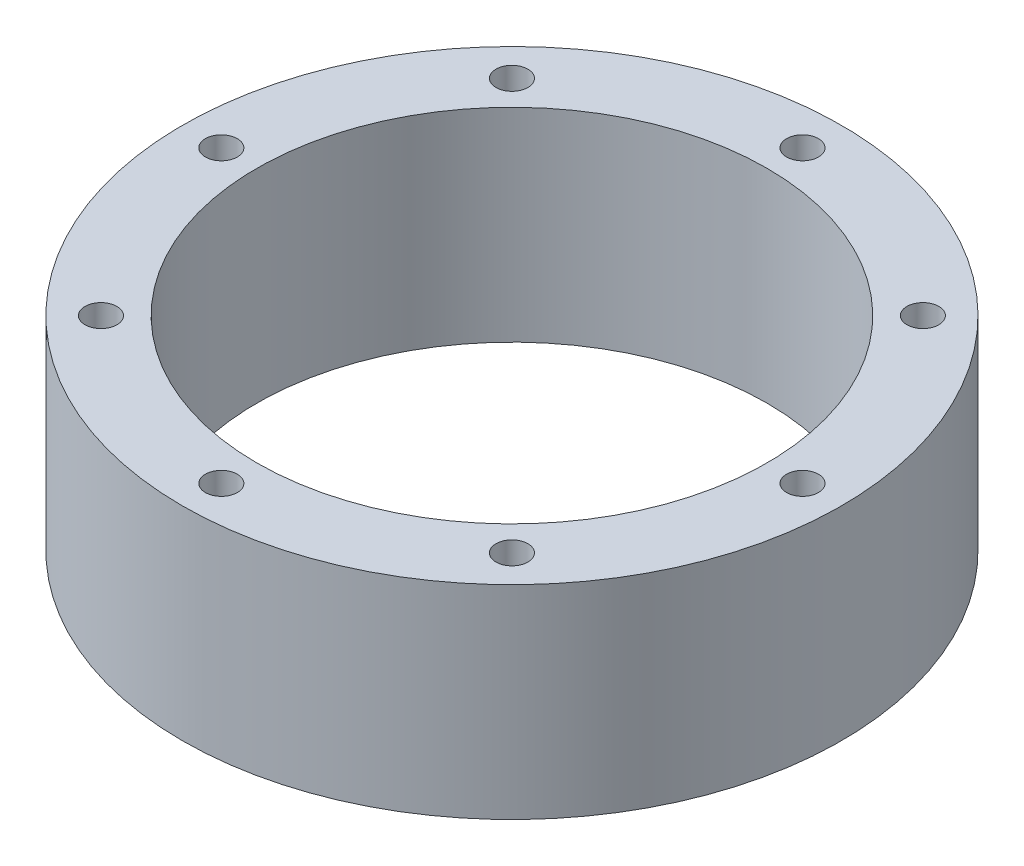
from build123d import *

# Parameters (mm, degrees)
SKETCH1_R           = 46.5
SKETCH1_R_2         = 36
BOSS_EXTRUDE1_DEPTH = 28.7
SKETCH2_R           = 2.25
CUT_EXTRUDE1_DEPTH  = 72.750888496


with BuildPart() as part:
    # Sketch1 → Boss-Extrude1 (new body)
    with BuildSketch(Plane(origin=(0, 0, 0), x_dir=(1, 0, 0), z_dir=(0, 1, 0))):
        Circle(SKETCH1_R)
        Circle(SKETCH1_R_2, mode=Mode.SUBTRACT)
    extrude(amount=BOSS_EXTRUDE1_DEPTH)

    # Sketch2 → Cut-Extrude1 (cut, through all)
    with BuildSketch(Plane(origin=(0, 28.7, 0), x_dir=(1, 0, 0), z_dir=(0, 1, 0))):
        with Locations((0, 41)):
            Circle(SKETCH2_R)
        with Locations((28.991378029, 28.991378029)):
            Circle(SKETCH2_R)
        with Locations((41, 0)):
            Circle(SKETCH2_R)
        with Locations((28.991378029, -28.991378029)):
            Circle(SKETCH2_R)
        with Locations((0, -41)):
            Circle(SKETCH2_R)
        with Locations((-28.991378029, -28.991378029)):
            Circle(SKETCH2_R)
        with Locations((-41, 0)):
            Circle(SKETCH2_R)
        with Locations((-28.991378029, 28.991378029)):
            Circle(SKETCH2_R)
    extrude(amount=-CUT_EXTRUDE1_DEPTH, mode=Mode.SUBTRACT)


solid = part.part
